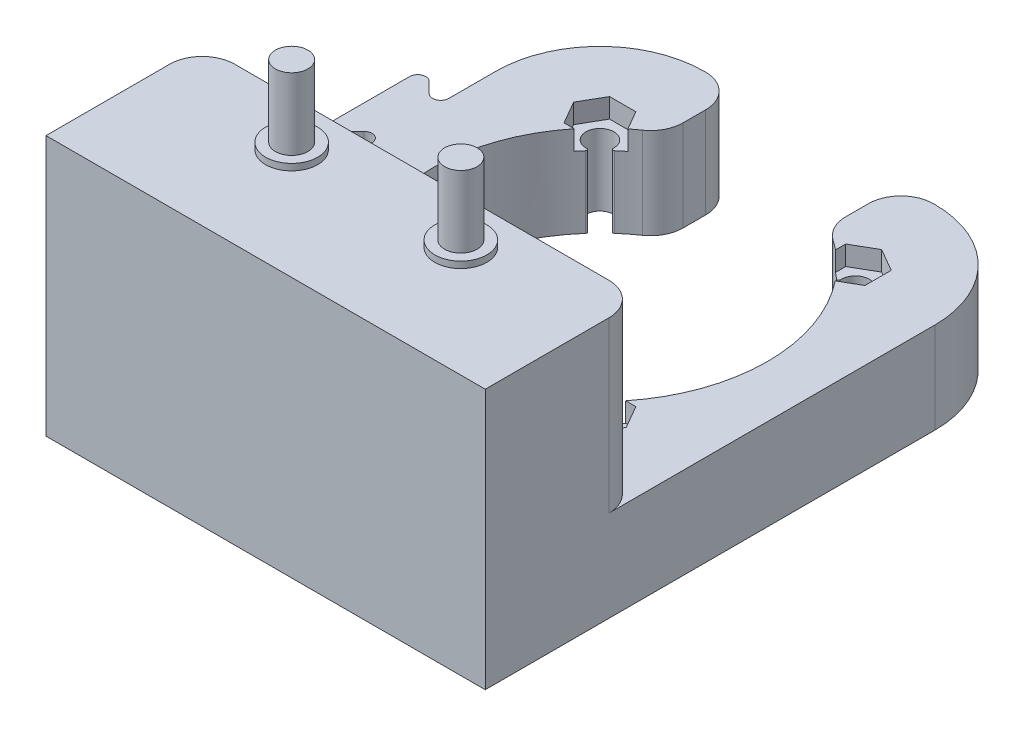
from build123d import *

# Parameters (mm, degrees)
SKETCH1_W           = 67.5
SKETCH1_H           = 85.123863618
BOSS_EXTRUDE1_DEPTH = 14
SKETCH2_W           = 67.5
SKETCH2_H           = 24
BOSS_EXTRUDE2_DEPTH = 26
SKETCH3_R           = 2.5
BOSS_EXTRUDE3_DEPTH = 12
FILLET1_R           = 0.25
SKETCH4_R           = 4
BOSS_EXTRUDE4_DEPTH = 1
SKETCH5_W           = 25
SKETCH5_H           = 20
CUT_EXTRUDE1_DEPTH  = 81.512957839
FILLET2_R           = 5
FILLET3_R           = 16
BOSS_EXTRUDE5_DEPTH = 14
CUT_EXTRUDE2_DEPTH  = 84.206588569
FILLET4_START       = -1
FILLET4_DEPTH       = 15
FILLET4_2_DEPTH     = 14
CUT_EXTRUDE3_DEPTH  = 3
CIRPATTERN1_COUNT   = 4


with BuildPart() as part:
    # Sketch1 → Boss-Extrude1 (new body)
    with BuildSketch(Plane(origin=(0, 0, 0), x_dir=(1, 0, 0), z_dir=(0, 1, 0))):
        with Locations((0, -8.811931809)):
            Rectangle(SKETCH1_W, SKETCH1_H)
        with BuildLine():
            ThreePointArc((18.737427526, 17.66270958), (23.93273134, 9.50194036), (25.75, 0))
            ThreePointArc((25.75, 0), (23.93273134, -9.50194036), (18.737427526, -17.66270958))
            ThreePointArc((18.737427526, -17.66270958), (20.788448756, -17.816003175), (21.772213178, -19.622213178))
            ThreePointArc((21.772213178, -19.622213178), (19.169682922, -21.724049605), (17.66270958, -18.737427526))
            ThreePointArc((17.66270958, -18.737427526), (0, -25.75), (-17.66270958, -18.737427526))
            ThreePointArc((-17.66270958, -18.737427526), (-17.52037675, -19.169682922), (-17.472213178, -19.622213178))
            ThreePointArc((-17.472213178, -19.622213178), (-21.428423181, -20.788448756), (-18.737427526, -17.66270958))
            ThreePointArc((-18.737427526, -17.66270958), (-25.75, 0), (-18.737427526, 17.66270958))
            ThreePointArc((-18.737427526, 17.66270958), (-21.428423181, 20.788448756), (-17.472213178, 19.622213178))
            ThreePointArc((-17.472213178, 19.622213178), (-17.52037675, 19.169682922), (-17.66270958, 18.737427526))
            ThreePointArc((-17.66270958, 18.737427526), (0, 25.75), (17.66270958, 18.737427526))
            ThreePointArc((17.66270958, 18.737427526), (19.169682922, 21.724049605), (21.772213178, 19.622213178))
            ThreePointArc((21.772213178, 19.622213178), (20.788448756, 17.816003175), (18.737427526, 17.66270958))
        make_face(mode=Mode.SUBTRACT)
    extrude(amount=BOSS_EXTRUDE1_DEPTH)

    # Sketch2 → Boss-Extrude2 (add)
    with BuildSketch(Plane(origin=(0, 14, 0), x_dir=(1, 0, 0), z_dir=(0, 1, 0))):
        with Locations((0, -39.373863618)):
            Rectangle(SKETCH2_W, SKETCH2_H)
    extrude(amount=BOSS_EXTRUDE2_DEPTH)

    # Sketch3 → Boss-Extrude3 (add)
    with BuildSketch(Plane(origin=(0, 40, 0), x_dir=(1, 0, 0), z_dir=(0, 1, 0))):
        with Locations(Location((13, -34.373863618, 0), (0, 0, 270))):
            Circle(SKETCH3_R)
        with Locations(Location((-13, -34.373863618, 0), (0, 0, 270))):
            Circle(SKETCH3_R)
    extrude(amount=BOSS_EXTRUDE3_DEPTH)

    # Fillet1
    fillet1_edges = [part.edges().sort_by_distance(p)[0] for p in [
        (-17.66270958, 7, 18.737427526),
        (17.66270958, 7, 18.737427526),
        (18.737427526, 7, 17.66270958),
        (18.737427526, 7, -17.66270958),
        (17.66270958, 7, -18.737427526),
        (-17.66270958, 7, -18.737427526),
        (-18.737427526, 7, -17.66270958),
        (-18.737427526, 7, 17.66270958),
    ]]
    fillet(fillet1_edges, radius=FILLET1_R)

    # Sketch4 → Boss-Extrude4 (add)
    with BuildSketch(Plane(origin=(0, 40, 0), x_dir=(1, 0, 0), z_dir=(0, 1, 0))):
        with Locations(Location((13, -34.373863618, 0), (0, 0, 270))):
            Circle(SKETCH4_R)
        with Locations(Location((-13, -34.373863618, 0), (0, 0, 270))):
            Circle(SKETCH4_R)
    extrude(amount=BOSS_EXTRUDE4_DEPTH)

    # Sketch5 → Cut-Extrude1 (cut, through all)
    with BuildSketch(Plane.XZ):
        with Locations((0, -23.75)):
            Rectangle(SKETCH5_W, SKETCH5_H)
    extrude(amount=-CUT_EXTRUDE1_DEPTH, mode=Mode.SUBTRACT)

    # Fillet2
    fillet2_edges = [part.edges().sort_by_distance(p)[0] for p in [
        (12.5, 7, -22.51249653),
        (-12.5, 7, -22.51249653),
        (12.5, 7, -33.75),
        (-12.5, 7, -33.75),
        (-33.75, 27, 27.373863618),
        (33.75, 27, 27.373863618),
    ]]
    fillet(fillet2_edges, radius=FILLET2_R)

    # Fillet3
    fillet3_edges = [part.edges().sort_by_distance(p)[0] for p in [
        (33.75, 7, -33.75),
        (-33.75, 7, -33.75),
    ]]
    fillet(fillet3_edges, radius=FILLET3_R)

    # Sketch6 → Boss-Extrude5 (add)
    with BuildSketch(Plane.XZ):
        Polygon((-33.75, 38.373863618), (-39.75, 44.373863618), (-39.75, 26.373863618), (-33.75, 32.373863618), align=None)
        Polygon((-39.75, 4.373863618), (-33.75, -1.626136382), (-33.75, -7.626136382), (-39.75, -13.626136382), align=None)
    extrude(amount=-BOSS_EXTRUDE5_DEPTH)

    # Sketch7 → Cut-Extrude2 (cut, through all)
    with BuildSketch(Plane.XZ):
        Polygon((-33.75, -7.626136382), (-33.75, -7.512999297), (-39.67, -13.432999297), (-39.67, 4.180726533), (-33.75, -1.739273467), (-33.75, -1.626136382), (-39.75, 4.373863618), (-39.75, -13.626136382), align=None)
        Polygon((-33.75, 32.373863618), (-33.75, 32.487000703), (-39.67, 26.567000703), (-39.67, 44.180726533), (-33.75, 38.260726533), (-33.75, 38.373863618), (-39.75, 44.373863618), (-39.75, 26.373863618), align=None)
    extrude(amount=-CUT_EXTRUDE2_DEPTH, mode=Mode.SUBTRACT)

    # Fillet4: read off the stored shape, not the designer's step
    # Fillet4 outline → Fillet4 (cut)
    with BuildSketch(Plane(origin=(0, 0, 0), x_dir=(1, 0, 0), z_dir=(0, 1, 0)).offset(FILLET4_START)):
        with BuildLine():
            Line((-39.67, -26.567000703), (-39.67, -29.584767656))
            ThreePointArc((-39.67, -29.584767656), (-38.898354291, -28.42991824), (-37.536116524, -28.700884179))
            Line((-37.536116524, -28.700884179), (-39.67, -26.567000703))
        make_face()
        with BuildLine():
            Line((-39.67, 13.432999297), (-39.67, 10.415232344))
            ThreePointArc((-39.67, 10.415232344), (-38.898354291, 11.57008176), (-37.536116524, 11.299115821))
            Line((-37.536116524, 11.299115821), (-39.67, 13.432999297))
        make_face()
        with BuildLine():
            Line((-39.67, -4.180726533), (-37.536116524, -2.046843056))
            ThreePointArc((-37.536116524, -2.046843056), (-38.89835429, -2.317808995), (-39.67, -1.16295958))
            Line((-39.67, -1.16295958), (-39.67, -4.180726533))
        make_face()
        with BuildLine():
            ThreePointArc((-37.536116524, -42.046843056), (-38.89835429, -42.317808995), (-39.67, -41.16295958))
            Line((-39.67, -41.16295958), (-39.67, -44.180726533))
            Line((-39.67, -44.180726533), (-37.536116524, -42.046843056))
        make_face()
    extrude(amount=FILLET4_DEPTH, mode=Mode.SUBTRACT)

    # Fillet4 2 outline → Fillet4 2 (add)
    with BuildSketch(Plane(origin=(0, 0, 0), x_dir=(1, 0, 0), z_dir=(0, 1, 0))):
        with BuildLine():
            ThreePointArc((-33.75, 10.53076625), (-34.52164571, 9.375916835), (-35.883883476, 9.646882774))
            Line((-35.883883476, 9.646882774), (-33.75, 7.512999297))
            Line((-33.75, 7.512999297), (-33.75, 10.53076625))
        make_face()
        with BuildLine():
            ThreePointArc((-35.883883476, -0.394610009), (-34.521645709, -0.12364407), (-33.75, -1.278493486))
            Line((-33.75, -1.278493486), (-33.75, 1.739273467))
            Line((-33.75, 1.739273467), (-35.883883476, -0.394610009))
        make_face()
        with BuildLine():
            ThreePointArc((-33.75, -29.46923375), (-34.52164571, -30.624083165), (-35.883883476, -30.353117226))
            Line((-35.883883476, -30.353117226), (-33.75, -32.487000703))
            Line((-33.75, -32.487000703), (-33.75, -29.46923375))
        make_face()
        with BuildLine():
            Line((-33.75, -38.260726533), (-35.883883476, -40.394610009))
            ThreePointArc((-35.883883476, -40.394610009), (-34.521645709, -40.12364407), (-33.75, -41.278493486))
            Line((-33.75, -41.278493486), (-33.75, -38.260726533))
        make_face()
    extrude(amount=FILLET4_2_DEPTH)

    # Sketch8 → Cut-Extrude3 (cut)
    with BuildSketch(Plane(origin=(0, 14, 0), x_dir=(1, 0, 0), z_dir=(0, 1, 0))):
        Polygon((-19.622213178, -15.580761294), (-16.122213178, -17.601487236), (-16.122213178, -21.64293912), (-19.622213178, -23.663665062), (-23.122213178, -21.64293912), (-23.122213178, -17.601487236), align=None)
    cut_extrude3 = extrude(amount=-CUT_EXTRUDE3_DEPTH, mode=Mode.SUBTRACT)

    # CirPattern1: Cut-Extrude3 ×4 about axis
    cirpattern1_axis = Axis((0, 0, 0), (0, 1, 0))
    for i in range(1, CIRPATTERN1_COUNT):
        add(cut_extrude3.rotate(cirpattern1_axis, i * 360 / CIRPATTERN1_COUNT), mode=Mode.SUBTRACT)


solid = part.part
